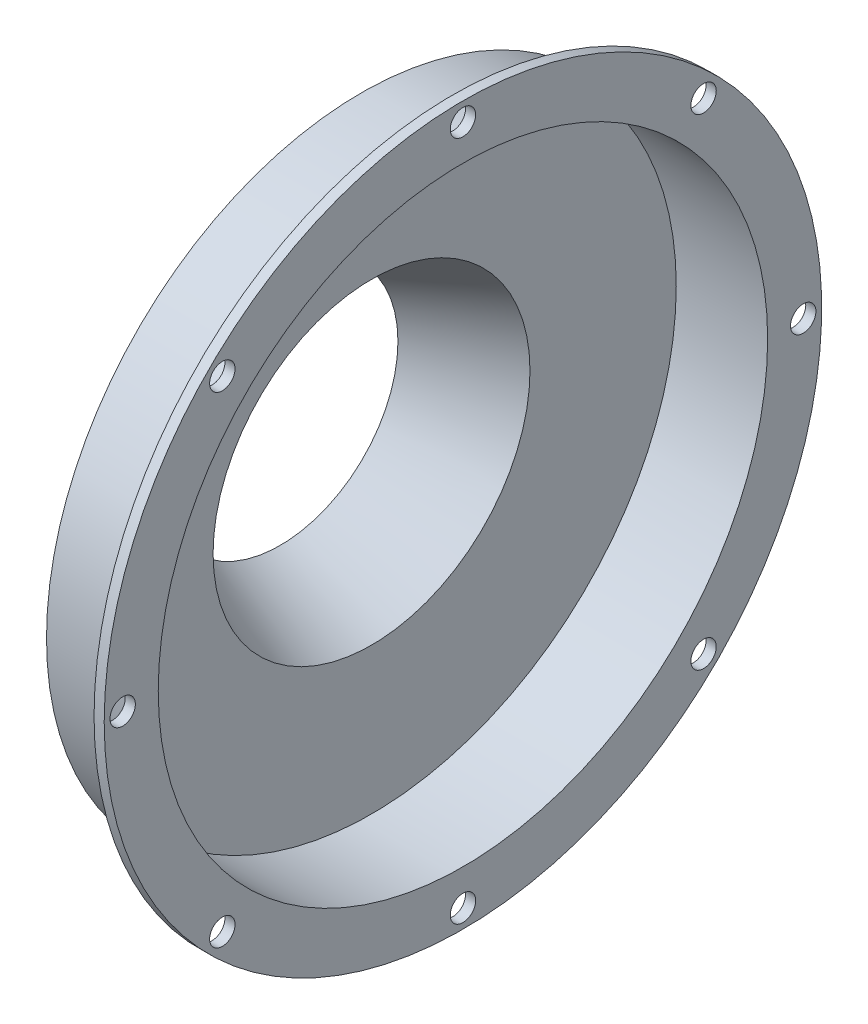
from build123d import *

# Parameters (mm, degrees)
SKETCH2_R          = 3.175
CUT_EXTRUDE1_DEPTH = 2.54
CIRPATTERN1_COUNT  = 8


with BuildPart() as part:
    # Sketch1 → Revolve1 (revolve)
    with BuildSketch(Plane.XY):
        Polygon((0, 29.464), (22.86, 39.624), (22.86, 76.2), (45.72, 76.2), (45.72, 89.7128), (43.18, 89.7128), (43.18, 78.74), (20.32, 78.74), (20.32, 41.274677646), (-1.031591704, 31.785081333), align=None)
    revolve(axis=Axis((0, 0, 0), (1, 0, 0)))

    # Sketch2 → Cut-Extrude1 (cut)
    with BuildSketch(Plane.ZY.offset(-43.18)):
        with Locations((0, 85.09)):
            Circle(SKETCH2_R)
    cut_extrude1 = extrude(amount=-CUT_EXTRUDE1_DEPTH, mode=Mode.SUBTRACT)

    # CirPattern1: Cut-Extrude1 ×8 about axis
    cirpattern1_axis = Axis((43.18, 0, 0), (-1, 0, 0))
    for i in range(1, CIRPATTERN1_COUNT):
        add(cut_extrude1.rotate(cirpattern1_axis, i * 360 / CIRPATTERN1_COUNT), mode=Mode.SUBTRACT)


solid = part.part
